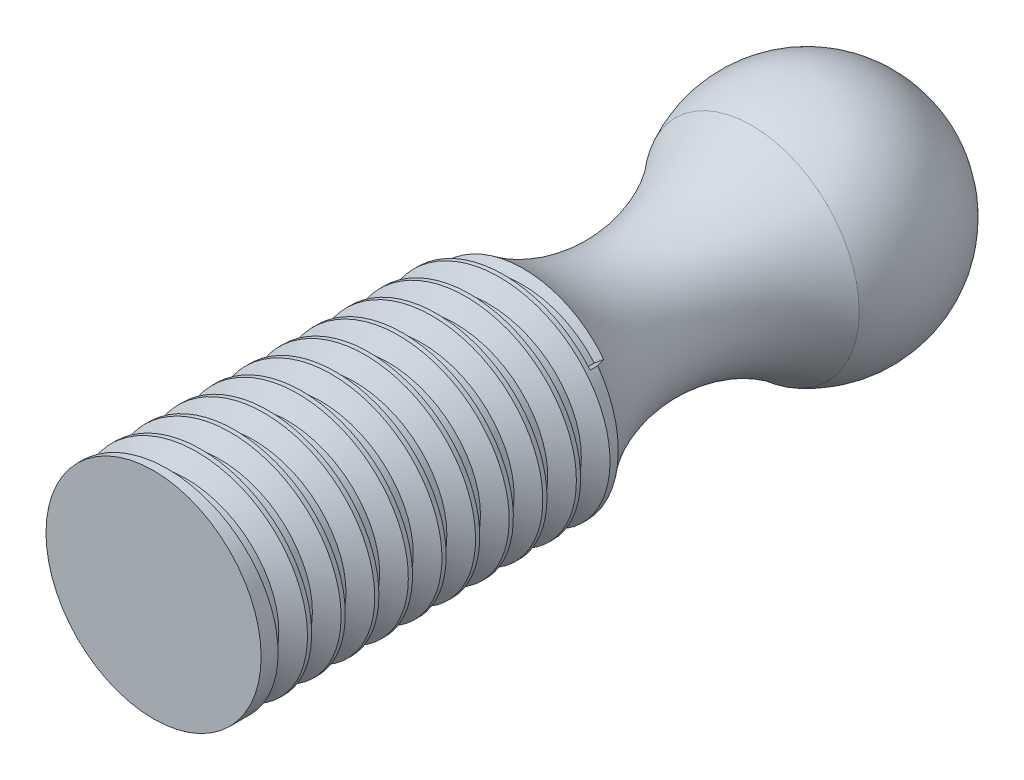
from build123d import *

# Parameters (mm, degrees)
SCHIZZO3_R                   = 4
ESTRUSIONE_ESTRUSIONE1_DEPTH = 24.3
FILETTATURA1_PITCH           = 1.25


with BuildPart() as part:
    # Schizzo2 → Rivoluzione1 (revolve)
    with BuildSketch(Plane.XY):
        with BuildLine():
            Line((13.397999688, -1.354593188), (22.397999688, -1.354593188))
            ThreePointArc((22.397999688, -1.354593188), (17.897999688, 3.145406812), (13.397999688, -1.354593188))
        make_face()
    revolve(axis=Axis((13.397999688, -1.354593188, 0), (1, 0, 0)))

    # Schizzo3 → Estrusione-Estrusione1 (add)
    with BuildSketch(Plane.XY):
        with Locations(Location((17.897999688, -1.354593188, 0), (0, 0, 180))):
            Circle(SCHIZZO3_R)
    extrude(amount=ESTRUSIONE_ESTRUSIONE1_DEPTH)

    # Filettatura1: the profile of Profilo filettatura1 profile screwed along a right-hand helix of 10.4 turns, 8 arcs to a turn; built about Z, then put on its axis
    filettatura1_z = Axis((0, 0, 0), (0, 0, 1))
    filettatura1_corners = [(4.0003, 0, -0.000173205), (4.0003, 0, 1.093923202), (3.323417656, 0, 0.703124998), (3.323417656, 0, 0.390624998)]
    with BuildLine(mode=Mode.PRIVATE) as filettatura1_profile:
        Line(filettatura1_corners[0], filettatura1_corners[1])
        Line(filettatura1_corners[1], filettatura1_corners[2])
        Line(filettatura1_corners[2], filettatura1_corners[3])
        Line(filettatura1_corners[3], filettatura1_corners[0])
    filettatura1_cap = Face(filettatura1_profile.wire())
    filettatura1_turn_angles = [0, 22.5, 45, 67.5, 90, 112.5, 135, 157.5, 180, 202.5, 225, 247.5, 270, 292.5, 315, 337.5, 360]
    filettatura1_turn_weights = [1, 0.9238795325112867, 1, 0.9238795325112867, 1, 0.9238795325112867, 1, 0.9238795325112867, 1, 0.9238795325112867, 1, 0.9238795325112867, 1, 0.9238795325112867, 1, 0.9238795325112867, 1]
    filettatura1_turn_rails = [Edge.make_bspline([Vector(p[0], p[1], 0).rotate(filettatura1_z, filettatura1_turn_angles[k]) / filettatura1_turn_weights[k] + Vector(0, 0, p[2] + FILETTATURA1_PITCH * filettatura1_turn_angles[k] / 360) for k in range(17)], [0, 0, 0, 1, 1, 2, 2, 3, 3, 4, 4, 5, 5, 6, 6, 7, 7, 8, 8, 8], 2, filettatura1_turn_weights) for p in filettatura1_corners]
    filettatura1_turn_sides = [Face.make_surface_from_curves(filettatura1_turn_rails[p[0]], filettatura1_turn_rails[p[1]]) for p in [(0, 1), (1, 2), (2, 3), (3, 0)]]
    filettatura1_last_angles = [3600, 3622.5, 3645, 3667.5, 3690, 3712.5, 3735, 3739.5, 3744]
    filettatura1_last_weights = [1, 0.9238795325112867, 1, 0.9238795325112867, 1, 0.9238795325112867, 1, 0.996917333733128, 1]
    filettatura1_last_rails = [Edge.make_bspline([Vector(p[0], p[1], 0).rotate(filettatura1_z, filettatura1_last_angles[k]) / filettatura1_last_weights[k] + Vector(0, 0, p[2] + FILETTATURA1_PITCH * filettatura1_last_angles[k] / 360) for k in range(9)], [0, 0, 0, 1, 1, 2, 2, 3, 3, 4, 4, 4], 2, filettatura1_last_weights) for p in filettatura1_corners]
    filettatura1_last_sides = [Face.make_surface_from_curves(filettatura1_last_rails[p[0]], filettatura1_last_rails[p[1]]) for p in [(0, 1), (1, 2), (2, 3), (3, 0)]]
    filettatura1 = Plane(origin=(17.897999688, -1.354593188, 24.3), x_dir=(-1, 0, 0), z_dir=(0, 0, -1)) * Solid(Shell([*[p.moved(Location((0, 0, FILETTATURA1_PITCH * i))) for i in range(10) for p in filettatura1_turn_sides], *filettatura1_last_sides, filettatura1_cap, filettatura1_cap.rotate(filettatura1_z, 3744).moved(Location((0, 0, FILETTATURA1_PITCH * 3744 / 360)))]))
    add(filettatura1, mode=Mode.SUBTRACT)

    # Schizzo5 → Taglia-Rivoluzione2 (revolve, cut)
    with BuildSketch(Plane(origin=(17.897999688, 0, 0), x_dir=(0, 0, -1), z_dir=(1, 0, 0)), mode=Mode.PRIVATE) as taglia_rivoluzione2_sk:
        with BuildLine():
            Line((-11.018750003, -5.354593188), (-2.061552813, -5.354593188))
            ThreePointArc((-2.061552813, -5.354593188), (-6.540151408, -3.734384505), (-11.018750003, -5.354593188))
        make_face()
    revolve(taglia_rivoluzione2_sk.sketch.rotate(Axis((17.897999688, -1.354593188, 24.299975), (0, 0, -1)), 270), axis=Axis((17.897999688, -1.354593188, 24.299975), (0, 0, -1)), mode=Mode.SUBTRACT)


solid = part.part
